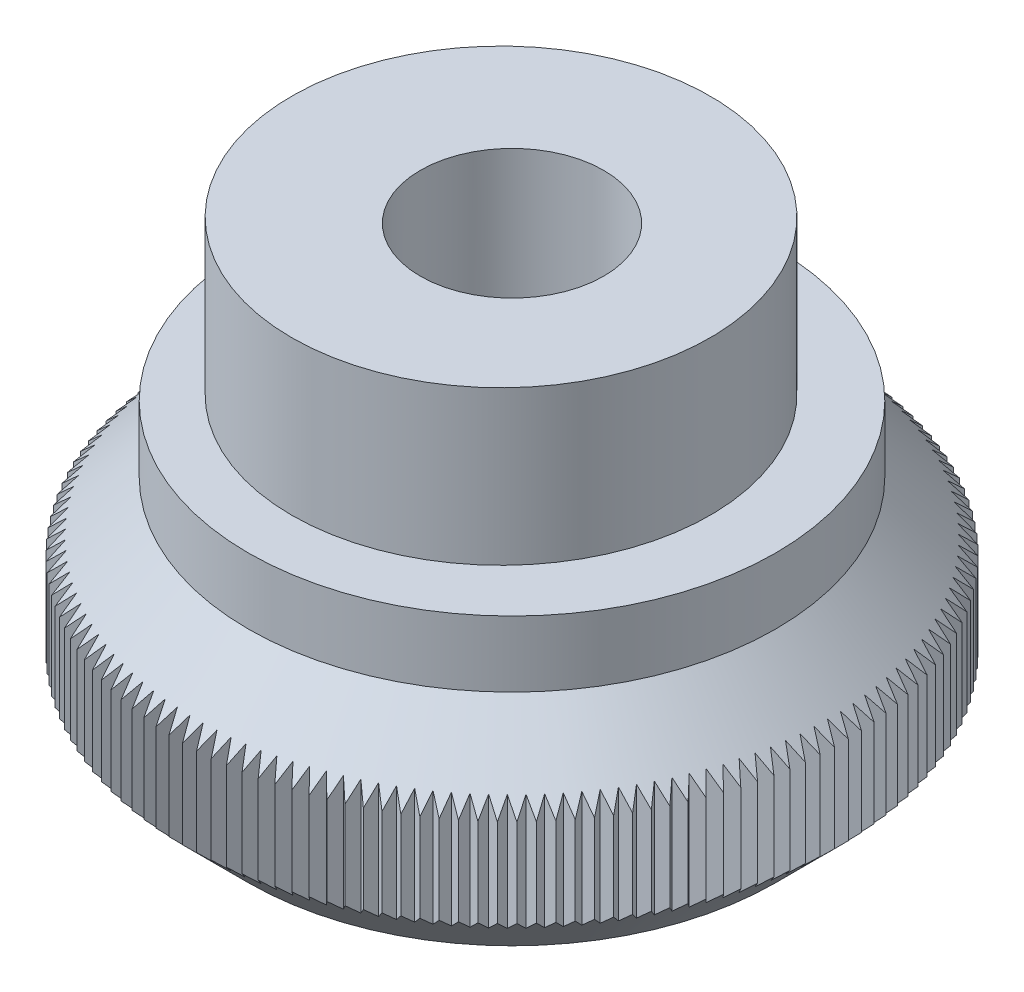
from build123d import *

# Parameters (mm, degrees)
SKETCH1_R           = 15
SKETCH1_R_2         = 4.175
BOSS_EXTRUDE1_DEPTH = 10
SKETCH2_R           = 9.525
SKETCH2_R_2         = 4.175
BOSS_EXTRUDE2_DEPTH = 10
CHAMFER1_SIZE       = 3
SKETCH4_R           = 5.5
CUT_EXTRUDE1_DEPTH  = 12.5
SKETCH5_R           = 18.359151502
CUT_EXTRUDE2_DEPTH  = 24.452078799
SKETCH6_R           = 12
SKETCH6_R_2         = 9.525
BOSS_EXTRUDE3_DEPTH = 3
SKETCH7_R           = 4.175
BOSS_EXTRUDE4_DEPTH = 1


with BuildPart() as part:
    # Sketch1 → Boss-Extrude1 (new body)
    with BuildSketch(Plane(origin=(0, 0, 0), x_dir=(1, 0, 0), z_dir=(0, 1, 0))):
        Circle(SKETCH1_R)
        Circle(SKETCH1_R_2, mode=Mode.SUBTRACT)
    extrude(amount=BOSS_EXTRUDE1_DEPTH)

    # Sketch2 → Boss-Extrude2 (add)
    with BuildSketch(Plane(origin=(0, 10, 0), x_dir=(1, 0, 0), z_dir=(0, 1, 0))):
        with Locations((-0.5, 0)):
            Circle(SKETCH2_R)
        Circle(SKETCH2_R_2, mode=Mode.SUBTRACT)
    extrude(amount=BOSS_EXTRUDE2_DEPTH)

    # Chamfer1
    chamfer1_edges = [part.edges().sort_by_distance(p)[0] for p in [
        (-15, 10, 0),
        (-15, 0, 0),
    ]]
    chamfer(chamfer1_edges, length=CHAMFER1_SIZE)

    # Sketch4 → Cut-Extrude1 (cut)
    with BuildSketch(Plane.XZ):
        Circle(SKETCH4_R)
    extrude(amount=-CUT_EXTRUDE1_DEPTH, mode=Mode.SUBTRACT)

    # Sketch5 → Cut-Extrude2 (cut, through all)
    with BuildSketch(Plane(origin=(0, 10, 0), x_dir=(1, 0, 0), z_dir=(0, 1, 0))):
        Circle(SKETCH5_R)
        Polygon((-0.300761904, 14.358223338), (0, 15), (0.300761904, 14.358223338), (0.628134806, 14.986842451), (0.901758073, 14.333034135), (1.25516765, 14.947392889), (1.501172253, 14.28269992), (1.879998503, 14.88172052), (2.097952866, 14.207308996), (2.501531201, 14.789940556), (2.691052956, 14.106993624), (3.118675362, 14.672214011), (3.279432026, 13.981929792), (3.730348307, 14.528747417), (3.862057857, 13.832336905), (4.335476954, 14.359792463), (4.437908327, 13.658477397), (4.932999701, 14.165645554), (5.005973197, 13.46065628), (5.52186829, 13.946647288), (5.56525589, 13.239220597), (6.101049646, 13.703181865), (6.114775232, 12.994558823), (6.669527688, 13.435676404), (6.653567181, 12.727100177), (7.226305112, 13.144600201), (7.180686512, 12.437313872), (7.770405141, 12.830463902), (7.695208479, 12.125708293), (8.300873239, 12.493818611), (8.196230435, 11.792830101), (8.816778784, 12.135254916), (8.682873419, 11.439263278), (9.317216704, 11.75540186), (9.154283691, 11.065628099), (9.80130906, 11.354925835), (9.60963424, 10.67258005), (10.268206589, 10.934529411), (10.048126224, 10.260808668), (10.717090194, 10.494950108), (10.468990381, 9.831036341), (11.147172382, 10.036959095), (10.871488372, 9.384017035), (11.557698642, 9.561359846), (11.254914077, 8.920534976), (11.94794877, 9.068986723), (11.618594839, 8.441403266), (12.317238137, 8.560703515), (11.961892637, 7.947462467), (12.664918883, 8.037401925), (12.284205212, 7.439579118), (12.990381057, 7.5), (12.584967116, 6.918644219), (13.293053688, 6.949440527), (12.863650711, 6.385571668), (13.572405787, 6.386689373), (13.119767092, 5.841296654), (13.827947274, 5.812733797), (13.352866943, 5.28677402), (14.059229842, 5.22858071), (13.562541328, 4.722976589), (14.265847744, 4.635254916), (13.748422407, 4.150893452), (14.447438502, 4.033797309), (13.910184082, 3.571528237), (14.603683543, 3.425263052), (14.047542567, 2.985897348), (14.734308761, 2.810719719), (14.160256889, 2.39502818), (14.839084994, 2.191245428), (14.248129308, 1.79995732), (14.917828431, 1.567926949), (14.311005667, 1.201728722), (14.970400926, 0.941857793), (14.34877566, 0.601391884), (14.996710252, 0.314136298), (14.361373024, 0), (14.996710252, -0.314136298), (14.34877566, -0.601391884), (14.970400926, -0.941857793), (14.311005667, -1.201728722), (14.917828431, -1.567926949), (14.248129308, -1.79995732), (14.839084994, -2.191245428), (14.160256889, -2.39502818), (14.734308761, -2.810719719), (14.047542567, -2.985897348), (14.603683543, -3.425263052), (13.910184082, -3.571528237), (14.447438502, -4.033797309), (13.748422407, -4.150893452), (14.265847744, -4.635254916), (13.562541328, -4.722976589), (14.059229842, -5.22858071), (13.352866943, -5.28677402), (13.827947274, -5.812733797), (13.119767092, -5.841296654), (13.572405787, -6.386689373), (12.863650711, -6.385571668), (13.293053688, -6.949440527), (12.584967116, -6.918644219), (12.990381057, -7.5), (12.284205212, -7.439579118), (12.664918883, -8.037401925), (11.961892637, -7.947462467), (12.317238137, -8.560703515), (11.618594839, -8.441403266), (11.94794877, -9.068986723), (11.254914077, -8.920534976), (11.557698642, -9.561359846), (10.871488372, -9.384017035), (11.147172382, -10.036959095), (10.468990381, -9.831036341), (10.717090194, -10.494950108), (10.048126224, -10.260808668), (10.268206589, -10.934529411), (9.60963424, -10.67258005), (9.80130906, -11.354925835), (9.154283691, -11.065628099), (9.317216704, -11.75540186), (8.682873419, -11.439263278), (8.816778784, -12.135254916), (8.196230435, -11.792830101), (8.300873239, -12.493818611), (7.695208479, -12.125708293), (7.770405141, -12.830463902), (7.180686512, -12.437313872), (7.226305112, -13.144600201), (6.653567181, -12.727100177), (6.669527688, -13.435676404), (6.114775232, -12.994558823), (6.101049646, -13.703181865), (5.56525589, -13.239220597), (5.52186829, -13.946647288), (5.005973197, -13.46065628), (4.932999701, -14.165645554), (4.437908327, -13.658477397), (4.335476954, -14.359792463), (3.862057857, -13.832336905), (3.730348307, -14.528747417), (3.279432026, -13.981929792), (3.118675362, -14.672214011), (2.691052956, -14.106993624), (2.501531201, -14.789940556), (2.097952866, -14.207308996), (1.879998503, -14.88172052), (1.501172253, -14.28269992), (1.25516765, -14.947392889), (0.901758073, -14.333034135), (0.628134806, -14.986842451), (0.300761904, -14.358223338), (0, -15), (-0.300761904, -14.358223338), (-0.628134806, -14.986842451), (-0.901758073, -14.333034135), (-1.25516765, -14.947392889), (-1.501172253, -14.28269992), (-1.879998503, -14.88172052), (-2.097952866, -14.207308996), (-2.501531201, -14.789940556), (-2.691052956, -14.106993624), (-3.118675362, -14.672214011), (-3.279432026, -13.981929792), (-3.730348307, -14.528747417), (-3.862057857, -13.832336905), (-4.335476954, -14.359792463), (-4.437908327, -13.658477397), (-4.932999701, -14.165645554), (-5.005973197, -13.46065628), (-5.52186829, -13.946647288), (-5.56525589, -13.239220597), (-6.101049646, -13.703181865), (-6.114775232, -12.994558823), (-6.669527688, -13.435676404), (-6.653567181, -12.727100177), (-7.226305112, -13.144600201), (-7.180686512, -12.437313872), (-7.770405141, -12.830463902), (-7.695208479, -12.125708293), (-8.300873239, -12.493818611), (-8.196230435, -11.792830101), (-8.816778784, -12.135254916), (-8.682873419, -11.439263278), (-9.317216704, -11.75540186), (-9.154283691, -11.065628099), (-9.80130906, -11.354925835), (-9.60963424, -10.67258005), (-10.268206589, -10.934529411), (-10.048126224, -10.260808668), (-10.717090194, -10.494950108), (-10.468990381, -9.831036341), (-11.147172382, -10.036959095), (-10.871488372, -9.384017035), (-11.557698642, -9.561359846), (-11.254914077, -8.920534976), (-11.94794877, -9.068986723), (-11.618594839, -8.441403266), (-12.317238137, -8.560703515), (-11.961892637, -7.947462467), (-12.664918883, -8.037401925), (-12.284205212, -7.439579118), (-12.990381057, -7.5), (-12.584967116, -6.918644219), (-13.293053688, -6.949440527), (-12.863650711, -6.385571668), (-13.572405787, -6.386689373), (-13.119767092, -5.841296654), (-13.827947274, -5.812733797), (-13.352866943, -5.28677402), (-14.059229842, -5.22858071), (-13.562541328, -4.722976589), (-14.265847744, -4.635254916), (-13.748422407, -4.150893452), (-14.447438502, -4.033797309), (-13.910184082, -3.571528237), (-14.603683543, -3.425263052), (-14.047542567, -2.985897348), (-14.734308761, -2.810719719), (-14.160256889, -2.39502818), (-14.839084994, -2.191245428), (-14.248129308, -1.79995732), (-14.917828431, -1.567926949), (-14.311005667, -1.201728722), (-14.970400926, -0.941857793), (-14.34877566, -0.601391884), (-14.996710252, -0.314136298), (-14.361373024, 0), (-14.996710252, 0.314136298), (-14.34877566, 0.601391884), (-14.970400926, 0.941857793), (-14.311005667, 1.201728722), (-14.917828431, 1.567926949), (-14.248129308, 1.79995732), (-14.839084994, 2.191245428), (-14.160256889, 2.39502818), (-14.734308761, 2.810719719), (-14.047542567, 2.985897348), (-14.603683543, 3.425263052), (-13.910184082, 3.571528237), (-14.447438502, 4.033797309), (-13.748422407, 4.150893452), (-14.265847744, 4.635254916), (-13.562541328, 4.722976589), (-14.059229842, 5.22858071), (-13.352866943, 5.28677402), (-13.827947274, 5.812733797), (-13.119767092, 5.841296654), (-13.572405787, 6.386689373), (-12.863650711, 6.385571668), (-13.293053688, 6.949440527), (-12.584967116, 6.918644219), (-12.990381057, 7.5), (-12.284205212, 7.439579118), (-12.664918883, 8.037401925), (-11.961892637, 7.947462467), (-12.317238137, 8.560703515), (-11.618594839, 8.441403266), (-11.94794877, 9.068986723), (-11.254914077, 8.920534976), (-11.557698642, 9.561359846), (-10.871488372, 9.384017035), (-11.147172382, 10.036959095), (-10.468990381, 9.831036341), (-10.717090194, 10.494950108), (-10.048126224, 10.260808668), (-10.268206589, 10.934529411), (-9.60963424, 10.67258005), (-9.80130906, 11.354925835), (-9.154283691, 11.065628099), (-9.317216704, 11.75540186), (-8.682873419, 11.439263278), (-8.816778784, 12.135254916), (-8.196230435, 11.792830101), (-8.300873239, 12.493818611), (-7.695208479, 12.125708293), (-7.770405141, 12.830463902), (-7.180686512, 12.437313872), (-7.226305112, 13.144600201), (-6.653567181, 12.727100177), (-6.669527688, 13.435676404), (-6.114775232, 12.994558823), (-6.101049646, 13.703181865), (-5.56525589, 13.239220597), (-5.52186829, 13.946647288), (-5.005973197, 13.46065628), (-4.932999701, 14.165645554), (-4.437908327, 13.658477397), (-4.335476954, 14.359792463), (-3.862057857, 13.832336905), (-3.730348307, 14.528747417), (-3.279432026, 13.981929792), (-3.118675362, 14.672214011), (-2.691052956, 14.106993624), (-2.501531201, 14.789940556), (-2.097952866, 14.207308996), (-1.879998503, 14.88172052), (-1.501172253, 14.28269992), (-1.25516765, 14.947392889), (-0.901758073, 14.333034135), (-0.628134806, 14.986842451), align=None, mode=Mode.SUBTRACT)
    extrude(amount=-CUT_EXTRUDE2_DEPTH, mode=Mode.SUBTRACT)

    # Sketch6 → Boss-Extrude3 (add)
    with BuildSketch(Plane(origin=(0, 10, 0), x_dir=(1, 0, 0), z_dir=(0, 1, 0))):
        Circle(SKETCH6_R)
        with Locations((-0.5, 0)):
            Circle(SKETCH6_R_2, mode=Mode.SUBTRACT)
    extrude(amount=BOSS_EXTRUDE3_DEPTH)

    # Sketch7 → Boss-Extrude4 (add)
    with BuildSketch(Plane.XZ.offset(-12.5)):
        Circle(SKETCH7_R)
    extrude(amount=-BOSS_EXTRUDE4_DEPTH)


solid = part.part
